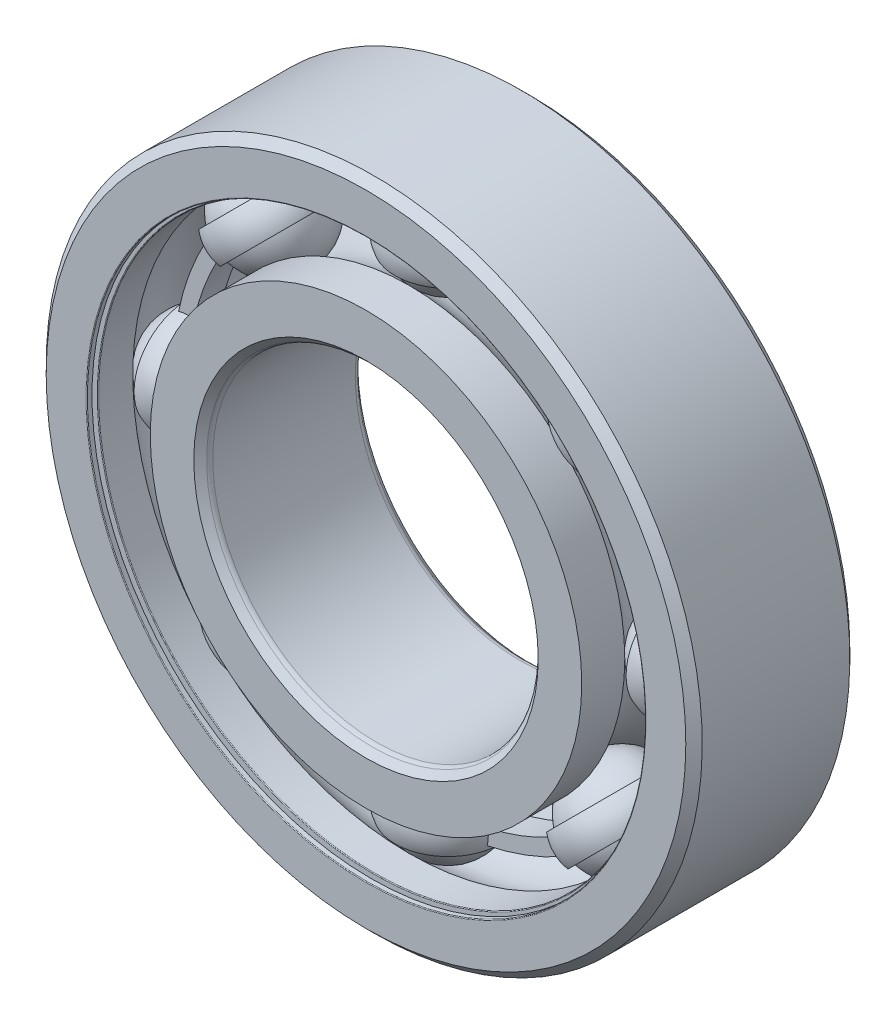
from build123d import *

# Parameters (mm, degrees)
BOSS_EXTRUDE1_DEPTH = 0.5
CIRPATTERN1_COUNT   = 8
CIRPATTERN2_COUNT   = 8
FILLET1_R           = 0.027
FILLET2_R           = 0.225


with BuildPart() as part:
    # Sketch3 → Revolve1 (revolve)
    with BuildSketch(Plane(origin=(0, 0, 0), x_dir=(0, 0, -1), z_dir=(1, 0, 0))):
        with BuildLine():
            Line((2.7, 12), (3, 11.7))
            Line((3, 11.7), (3, 10.107692308))
            Line((3, 10.107692308), (1.425, 10.107692308))
            ThreePointArc((1.425, 10.107692308), (0, 10.804884276), (-1.425, 10.107692308))
            Line((-1.425, 10.107692308), (-3, 10.107692308))
            Line((-3, 10.107692308), (-3, 11.7))
            Line((-3, 11.7), (-2.7, 12))
            Line((-2.7, 12), (2.7, 12))
        make_face()
    revolve(axis=Axis((0, 0, 3), (0, 0, -1)))

    # Sketch8 → Cut-Revolve1 (revolve, cut)
    with BuildSketch(Plane(origin=(0, 0, 0), x_dir=(0, 0, -1), z_dir=(1, 0, 0))):
        Polygon((-2.808, 10.107692308), (-2.7, 10.107692308), (-2.7, 10.738461538), (-2.808, 10.738461538), (-2.808, 10.215692308), (-3, 10.215692308), (-3, 10.107692308), align=None)
        Polygon((2.7, 10.107692308), (2.808, 10.107692308), (3, 10.107692308), (3, 10.215692308), (2.808, 10.215692308), (2.808, 10.738461538), (2.7, 10.738461538), align=None)
    revolve(axis=Axis((0, 0, 3), (0, 0, -1)), mode=Mode.SUBTRACT)

    # Fillet1
    fillet1_edges = [part.edges().sort_by_distance(p)[0] for p in [
        (0, -10.107692308, -2.7),
        (0, -10.215692308, -3),
        (0, -10.107692308, 2.7),
        (0, -10.215692308, 3),
    ]]
    fillet(fillet1_edges, radius=FILLET1_R)


with BuildPart() as body_2:
    # Sketch4 → Revolve2 (revolve)
    with BuildSketch(Plane(origin=(0, 0, 0), x_dir=(0, 0, -1), z_dir=(1, 0, 0))):
        with BuildLine():
            Line((-2.7, 6), (-3, 6.3))
            Line((-3, 6.3), (-3, 7.892307692))
            Line((-3, 7.892307692), (-1.425, 7.892307692))
            ThreePointArc((-1.425, 7.892307692), (0, 7.195115724), (1.425, 7.892307692))
            Line((1.425, 7.892307692), (3, 7.892307692))
            Line((3, 7.892307692), (3, 6.3))
            Line((3, 6.3), (2.7, 6))
            Line((2.7, 6), (-2.7, 6))
        make_face()
    revolve(axis=Axis((0, 0, 3), (0, 0, -1)))

    # Fillet2
    fillet2_edges = [body_2.edges().sort_by_distance(p)[0] for p in [
        (0, -6, -2.7),
        (0, -6, 2.7),
    ]]
    fillet(fillet2_edges, radius=FILLET2_R)


with BuildPart() as body_3:
    # Sketch5 → Revolve3 (revolve)
    with BuildSketch(Plane(origin=(0, 0, 0), x_dir=(0, 0, -1), z_dir=(1, 0, 0))):
        with BuildLine():
            Line((-1.804884276, 9), (1.804884276, 9))
            ThreePointArc((1.804884276, 9), (0, 10.804884276), (-1.804884276, 9))
        make_face()
    revolve(axis=Axis((0, 9, 1.804884276), (0, 0, -1)))


with BuildPart() as body_4:
    # Sketch6 → Revolve4 (revolve)
    with BuildSketch(Plane(origin=(0, 0, 0), x_dir=(0, 0, -1), z_dir=(1, 0, 0))):
        with BuildLine():
            Line((-1.717807232, 9.553846154), (-1.931506027, 9.553846154))
            ThreePointArc((-1.931506027, 9.553846154), (-2.038355424, 9), (-1.931506027, 8.446153846))
            Line((-1.931506027, 8.446153846), (-1.717807232, 8.446153846))
            ThreePointArc((-1.717807232, 8.446153846), (-1.804884276, 9), (-1.717807232, 9.553846154))
        make_face()
    revolve4 = revolve(axis=Axis((0, 12, 0), (0, -1, 0)))

    # Sketch7 → Boss-Extrude1 (add, symmetric)
    with BuildSketch(Plane.XY):
        with BuildLine():
            Line((6.363961031, 6.363961031), (6.755589402, 6.755589402))
            ThreePointArc((6.755589402, 6.755589402), (3.656098638, 8.826602918), (0, 9.553846154))
            Line((0, 9.553846154), (0, 9))
            ThreePointArc((0, 9), (3.444150891, 8.314915793), (6.363961031, 6.363961031))
        make_face()
    boss_extrude1 = extrude(amount=BOSS_EXTRUDE1_DEPTH, both=True)

    # CirPattern2: Revolve4, Boss-Extrude1 ×8 about axis
    cirpattern2_axis = Axis((0, 0, 3), (0, 0, -1))
    add([revolve4.rotate(cirpattern2_axis, i * 360 / CIRPATTERN2_COUNT) for i in range(1, CIRPATTERN2_COUNT)])
    add([boss_extrude1.rotate(cirpattern2_axis, i * 360 / CIRPATTERN2_COUNT) for i in range(1, CIRPATTERN2_COUNT)])


with BuildPart() as cirpattern1_1:
    # CirPattern1: pattern copy
    add(body_3.part.rotate(Axis((0, 0, 3), (0, 0, -1)), 1 * 360 / CIRPATTERN1_COUNT))


with BuildPart() as cirpattern1_2:
    # CirPattern1: pattern copy
    add(body_3.part.rotate(Axis((0, 0, 3), (0, 0, -1)), 2 * 360 / CIRPATTERN1_COUNT))


with BuildPart() as cirpattern1_3:
    # CirPattern1: pattern copy
    add(body_3.part.rotate(Axis((0, 0, 3), (0, 0, -1)), 3 * 360 / CIRPATTERN1_COUNT))


with BuildPart() as cirpattern1_4:
    # CirPattern1: pattern copy
    add(body_3.part.rotate(Axis((0, 0, 3), (0, 0, -1)), 4 * 360 / CIRPATTERN1_COUNT))


with BuildPart() as cirpattern1_5:
    # CirPattern1: pattern copy
    add(body_3.part.rotate(Axis((0, 0, 3), (0, 0, -1)), 5 * 360 / CIRPATTERN1_COUNT))


with BuildPart() as cirpattern1_6:
    # CirPattern1: pattern copy
    add(body_3.part.rotate(Axis((0, 0, 3), (0, 0, -1)), 6 * 360 / CIRPATTERN1_COUNT))


with BuildPart() as cirpattern1_7:
    # CirPattern1: pattern copy
    add(body_3.part.rotate(Axis((0, 0, 3), (0, 0, -1)), 7 * 360 / CIRPATTERN1_COUNT))


solid = Compound([part.part, body_2.part, body_3.part, body_4.part, cirpattern1_1.part, cirpattern1_2.part, cirpattern1_3.part, cirpattern1_4.part, cirpattern1_5.part, cirpattern1_6.part, cirpattern1_7.part])
